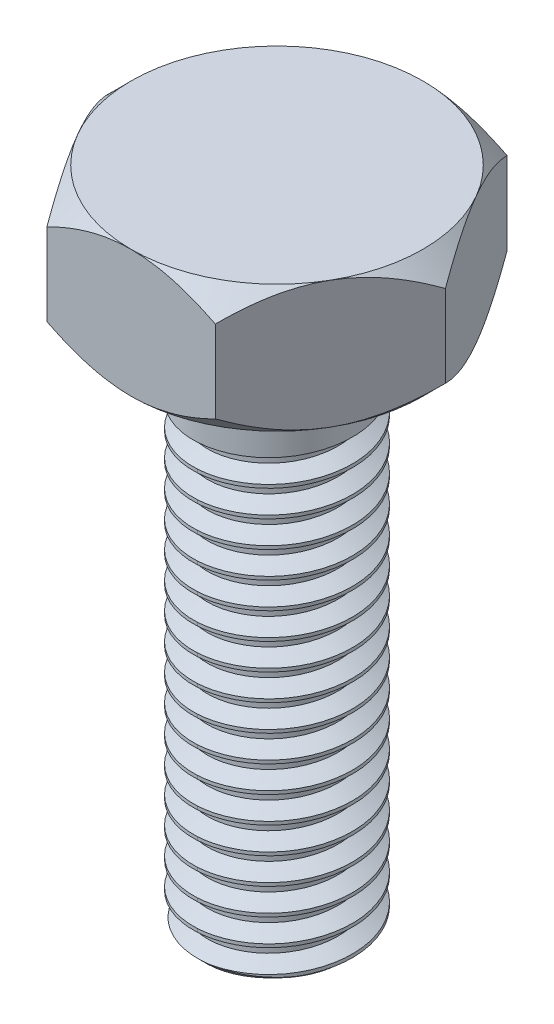
from build123d import *

# Parameters (mm, degrees)
BOSS_EXTRUDE1_DEPTH = 2.4
SKETCH11_OUTSIDE_W  = 21.774
SKETCH11_OUTSIDE_H  = 20.924
SKETCH11_OUTSIDE_R  = 2.75
CUT_EXTRUDE1_DEPTH  = 5.837957558
CUT_EXTRUDE1_DRAFT  = -45
SKETCH12_OUTSIDE_W  = 21.774
SKETCH12_OUTSIDE_H  = 20.924
SKETCH12_OUTSIDE_R  = 2.75
CUT_EXTRUDE2_DEPTH  = 5.837957558
CUT_EXTRUDE2_DRAFT  = -45
SKETCH2_R           = 1.5
BOSS_EXTRUDE2_DEPTH = 10
CHAMFER1_SIZE       = 0.2
THREAD1_PITCH       = 0.5
CUT_EXTRUDE3_DEPTH  = 11.846466491


with BuildPart() as part:
    # Sketch1 → Boss-Extrude1 (new body)
    with BuildSketch(Plane(origin=(0, 0, 0), x_dir=(1, 0, 0), z_dir=(0, 1, 0))):
        Polygon((3.175426481, 0), (1.58771324, 2.75), (-1.58771324, 2.75), (-3.175426481, 0), (-1.58771324, -2.75), (1.58771324, -2.75), align=None)
    extrude(amount=BOSS_EXTRUDE1_DEPTH)


with BuildPart() as cut_extrude1_tool:
    # Sketch11 outside → Cut-Extrude1 (with draft: the straight prism first)
    with BuildSketch(Plane.XZ):
        Rectangle(SKETCH11_OUTSIDE_W, SKETCH11_OUTSIDE_H)
        Circle(SKETCH11_OUTSIDE_R, mode=Mode.SUBTRACT)
    extrude(amount=-CUT_EXTRUDE1_DEPTH)
    # Cut-Extrude1: the draft: its side faces are tilted about the plane it starts from
    cut_extrude1_sides = [cut_extrude1_tool.faces().sort_by_distance(p)[0] for p in [
        (0, 2.918978779, -10.462),
        (10.887, 2.918978779, 0),
        (0, 2.918978779, 10.462),
        (-10.887, 2.918978779, 0),
        (-2.75, 2.918978779, 0),
    ]]
    draft(cut_extrude1_sides, Plane.XZ, CUT_EXTRUDE1_DRAFT)


with BuildPart() as part_1:
    add(part.part)

    # Cut-Extrude1: cut by cut_extrude1_tool
    add(cut_extrude1_tool.part, mode=Mode.SUBTRACT)


with BuildPart() as cut_extrude2_tool:
    # Sketch12 outside → Cut-Extrude2 (with draft: the straight prism first)
    with BuildSketch(Plane(origin=(0, 2.4, 0), x_dir=(1, 0, 0), z_dir=(0, 1, 0))):
        Rectangle(SKETCH12_OUTSIDE_W, SKETCH12_OUTSIDE_H)
        Circle(SKETCH12_OUTSIDE_R, mode=Mode.SUBTRACT)
    extrude(amount=-CUT_EXTRUDE2_DEPTH)
    # Cut-Extrude2: the draft: its side faces are tilted about the plane it starts from
    cut_extrude2_sides = [cut_extrude2_tool.faces().sort_by_distance(p)[0] for p in [
        (0, -0.518978779, 10.462),
        (10.887, -0.518978779, 0),
        (0, -0.518978779, -10.462),
        (-10.887, -0.518978779, 0),
        (-2.75, -0.518978779, 0),
    ]]
    draft(cut_extrude2_sides, Plane(origin=(0, 2.4, 0), x_dir=(1, 0, 0), z_dir=(0, 1, 0)), CUT_EXTRUDE2_DRAFT)


with BuildPart() as part_2:
    add(part_1.part)

    # Cut-Extrude2: cut by cut_extrude2_tool
    add(cut_extrude2_tool.part, mode=Mode.SUBTRACT)

    # Sketch2 → Boss-Extrude2 (add)
    with BuildSketch(Plane.XZ):
        with Locations(Location((0, 0, 0), (0, 0, 90))):
            Circle(SKETCH2_R)
    extrude(amount=BOSS_EXTRUDE2_DEPTH)

    # Chamfer1
    chamfer1_edges = [part_2.edges().sort_by_distance(p)[0] for p in [
        (0, -10, -1.5),
    ]]
    chamfer(chamfer1_edges, length=CHAMFER1_SIZE)

    # Thread1: the profile of Thread Profile2 profile screwed along a right-hand helix of 18 turns, 6 arcs to a turn; built about Z, then put on its axis
    thread1_z = Axis((0, 0, 0), (0, 0, 1))
    thread1_corners = [(1.5003, 0, -0.000173205), (1.5003, 0, 0.437673204), (1.229367063, 0, 0.281249999), (1.229367063, 0, 0.156249999)]
    with BuildLine(mode=Mode.PRIVATE) as thread1_profile:
        Line(thread1_corners[0], thread1_corners[1])
        Line(thread1_corners[1], thread1_corners[2])
        Line(thread1_corners[2], thread1_corners[3])
        Line(thread1_corners[3], thread1_corners[0])
    thread1_cap = Face(thread1_profile.wire())
    thread1_turn_angles = [0, 30, 60, 90, 120, 150, 180, 210, 240, 270, 300, 330, 360]
    thread1_turn_weights = [1, 0.8660254037844387, 1, 0.8660254037844387, 1, 0.8660254037844387, 1, 0.8660254037844387, 1, 0.8660254037844387, 1, 0.8660254037844387, 1]
    thread1_turn_rails = [Edge.make_bspline([Vector(p[0], p[1], 0).rotate(thread1_z, thread1_turn_angles[k]) / thread1_turn_weights[k] + Vector(0, 0, p[2] + THREAD1_PITCH * thread1_turn_angles[k] / 360) for k in range(13)], [0, 0, 0, 1, 1, 2, 2, 3, 3, 4, 4, 5, 5, 6, 6, 6], 2, thread1_turn_weights) for p in thread1_corners]
    thread1_turn_sides = [Face.make_surface_from_curves(thread1_turn_rails[p[0]], thread1_turn_rails[p[1]]) for p in [(0, 1), (1, 2), (2, 3), (3, 0)]]
    thread1 = Plane(origin=(0, -1, 0), x_dir=(-1, 0, 0), z_dir=(0, -1, 0)) * Solid(Shell([*[p.moved(Location((0, 0, THREAD1_PITCH * i))) for i in range(18) for p in thread1_turn_sides], thread1_cap, thread1_cap.rotate(thread1_z, 6480).moved(Location((0, 0, THREAD1_PITCH * 6480 / 360)))]))
    add(thread1, mode=Mode.SUBTRACT)

    # Sketch13 → Cut-Extrude3 (cut, through all)
    with BuildSketch(Plane(origin=(0, 0, 0), x_dir=(-1, 0, 0), z_dir=(0, 0, -1))):
        Polygon((1.5, -1), (1.229367063, -1.156249999), (1.229367063, -1.281249999), (1.5, -1.437499999), align=None)
    extrude(amount=-CUT_EXTRUDE3_DEPTH, mode=Mode.SUBTRACT)


solid = part_2.part
